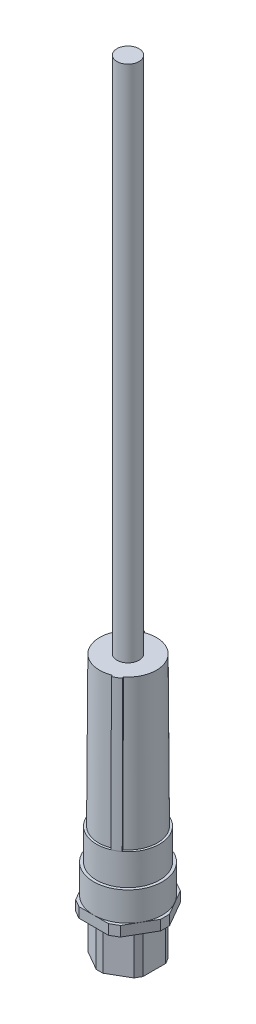
from build123d import *

# Parameters (mm, degrees)
BOSS_EXTRUDE1_DEPTH = 25.4
BOSS_EXTRUDE2_DEPTH = 6.1722
SKETCH4_R           = 21.0058
BOSS_EXTRUDE3_DEPTH = 17.653
LOFT1_START         = 49.2252
LOFT1_DEPTH         = 19.0754
SKETCH15_R          = 6.803443418
BOSS_EXTRUDE4_DEPTH = 317.5


# Read off the part's stored shape, not the designer's step: Loft1
with BuildPart() as part:
    # Sketch2 → Boss-Extrude1 (new body)
    with BuildSketch(Plane(origin=(0, 0, 0), x_dir=(1, 0, 0), z_dir=(0, 1, 0))):
        Polygon((16.1417, 6.966755479), (16.1417, -6.966755479), (14.104237227, -10.495744521), (2.037462773, -17.4625), (-2.037462773, -17.4625), (-14.104237227, -10.495744521), (-16.1417, -6.966755479), (-16.1417, 6.966755479), (-14.104237227, 10.495744521), (-2.037462773, 17.4625), (2.037462773, 17.4625), (14.104237227, 10.495744521), align=None)
    extrude(amount=BOSS_EXTRUDE1_DEPTH)

    # Sketch3 → Boss-Extrude2 (add)
    with BuildSketch(Plane(origin=(0, 25.4, 0), x_dir=(1, 0, 0), z_dir=(0, 1, 0))):
        Polygon((22.733, 2.687688992), (22.733, -2.687688992), (13.694106944, -18.343511008), (9.038893056, -21.0312), (-9.038893056, -21.0312), (-13.694106944, -18.343511008), (-22.733, -2.687688992), (-22.733, 2.687688992), (-13.694106944, 18.343511008), (-9.038893056, 21.0312), (9.038893056, 21.0312), (13.694106944, 18.343511008), align=None)
    extrude(amount=BOSS_EXTRUDE2_DEPTH)

    # Sketch4 → Boss-Extrude3 (add)
    with BuildSketch(Plane(origin=(0, 31.5722, 0), x_dir=(1, 0, 0), z_dir=(0, 1, 0))):
        with Locations(Location((0, 0, 0), (0, 0, 270))):
            Circle(SKETCH4_R)
    extrude(amount=BOSS_EXTRUDE3_DEPTH)

    # Loft1 outline → Loft1 (add)
    with BuildSketch(Plane(origin=(0, 0, 0), x_dir=(1, 0, 0), z_dir=(0, 1, 0)).offset(LOFT1_START)):
        with BuildLine():
            add(Edge.make_bspline(
                [(19.2913, 0), (19.2913, -0.532357902), (19.24807929, -1.587058624), (19.05856694, -3.134083623), (18.74935415, -4.641101692), (16.205759829, -13.413283461), (8.517726425, -19.2913), (-10.647158031, -19.2913), (-19.2913, -10.647158031), (-19.2913, 10.647158031), (-10.647158031, 19.2913), (8.517726425, 19.2913), (16.205759829, 13.413283461), (18.74935415, 4.641101692), (19.05856694, 3.134083623), (19.24807929, 1.587058624), (19.2913, 0.532357902), (19.2913, 0)],
                knots=[0, 0, 0, 0, 0.0125, 0.025, 0.0375, 0.05, 0.25, 0.25, 0.5, 0.5, 0.75, 0.75, 0.95, 0.9625, 0.975, 0.9875, 1, 1, 1, 1], degree=3))
        make_face()
    extrude(amount=LOFT1_DEPTH)

    # Sketch13 for Loft9 → Loft9 section 0
    with BuildSketch(Plane(origin=(0, 68.3006, 0), x_dir=(1, 0, 0), z_dir=(0, 1, 0))):
        with BuildLine():
            Line((-7.361972311, 17.831310086), (-6.695340025, 16.676669098))
            # circular arc as an exact rational Bezier (weights 1, cos(half-angle), 1)
            Bezier((-6.695340025, 16.676669098), (110.107584845, 63.57064375), (11.094749077, -14.136669098), weights=[1, 0.141342756, 1])
            Line((11.094749077, -14.136669098), (11.761381362, -15.291310086))
            Bezier((11.761381362, -15.291310086), (9.730360638, -16.853479001), (7.361972311, -17.831310086), weights=[1, 0.991294193, 1])
            Line((7.361972311, -17.831310086), (6.695340025, -16.676669098))
            Bezier((6.695340025, -16.676669098), (-110.107584845, -63.57064375), (-11.094749077, 14.136669098), weights=[1, 0.141342756, 1])
            Line((-11.094749077, 14.136669098), (-11.761381362, 15.291310086))
            Bezier((-11.761381362, 15.291310086), (-9.730360638, 16.853479001), (-7.361972311, 17.831310086), weights=[1, 0.991294193, 1])
        make_face()
    # Sketch14 for Loft9 → Loft9 section 1
    with BuildSketch(Plane(origin=(0, 159.5882, 0), x_dir=(1, 0, 0), z_dir=(0, 1, 0))):
        with BuildLine():
            Line((-6.939022131, 17.098738886), (-6.406595507, 16.176548922))
            Bezier((-6.406595507, 16.176548922), (103.215635603, 59.591575), (10.806004558, -13.636548922), weights=[1, 0.145985401, 1])
            Line((10.806004558, -13.636548922), (11.338431182, -14.558738886))
            Bezier((11.338431182, -14.558738886), (9.315217328, -16.134429695), (6.939022131, -17.098738886), weights=[1, 0.990481454, 1])
            Line((6.939022131, -17.098738886), (6.406595507, -16.176548922))
            Bezier((6.406595507, -16.176548922), (-103.215635603, -59.591575), (-10.806004558, 13.636548922), weights=[1, 0.145985401, 1])
            Line((-10.806004558, 13.636548922), (-11.338431182, 14.558738886))
            Bezier((-11.338431182, 14.558738886), (-9.315217328, 16.134429695), (-6.939022131, 17.098738886), weights=[1, 0.990481454, 1])
        make_face()
    loft()

    # Sketch15 → Boss-Extrude4 (add)
    with BuildSketch(Plane(origin=(0, 159.5882, 0), x_dir=(1, 0, 0), z_dir=(0, 1, 0))):
        with Locations(Location((0, 0, 0), (0, 0, 270))):
            Circle(SKETCH15_R)
    extrude(amount=BOSS_EXTRUDE4_DEPTH)


solid = part.part
